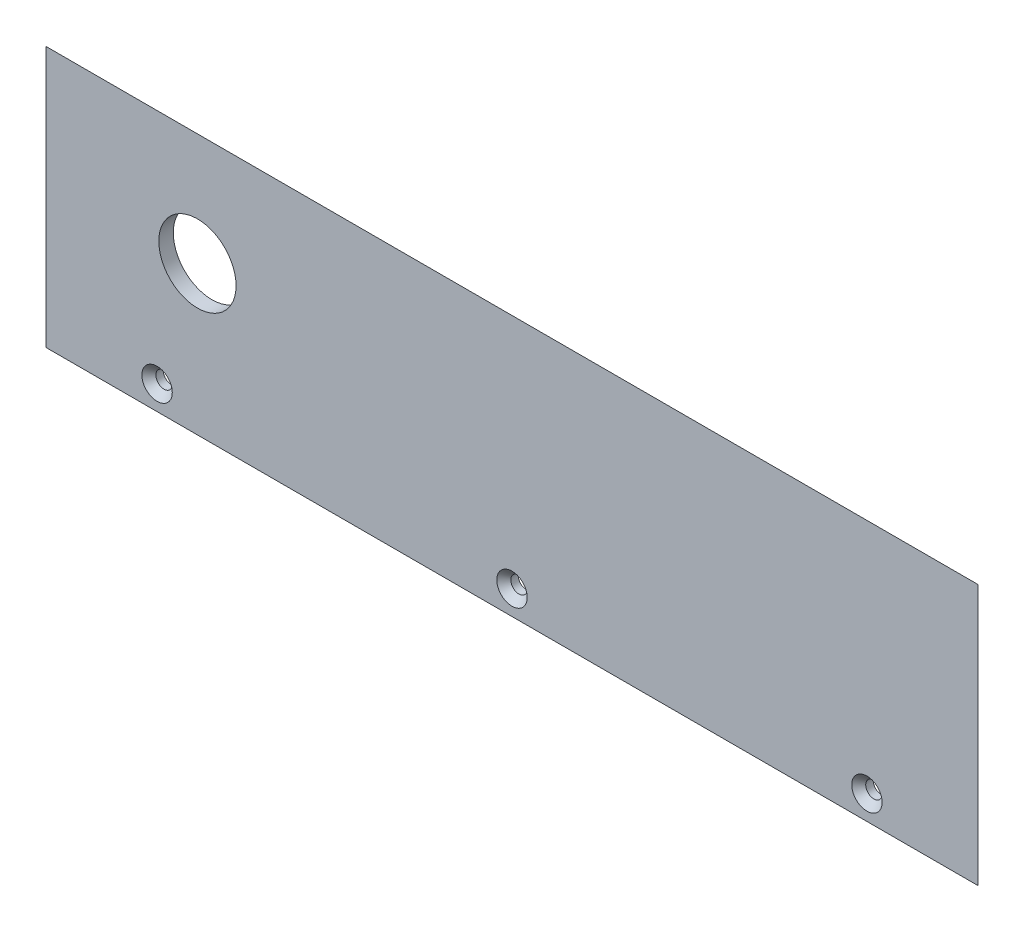
from build123d import *

# Parameters (mm, degrees)
SKETCH1_W                                      = 193
SKETCH1_H                                      = 54
BOSS_EXTRUDE1_DEPTH                            = 3
CHAMFER1_SIZE                                  = 3
CSK_FOR_M3_FLAT_HEAD_MACHINE_SCREW1_AT_2_COUNT = 2
CSK_FOR_M3_FLAT_HEAD_MACHINE_SCREW1_AT_2_PITCH = 73.5
CSK_FOR_M3_FLAT_HEAD_MACHINE_SCREW1_AT_3_COUNT = 2
CSK_FOR_M3_FLAT_HEAD_MACHINE_SCREW1_AT_3_PITCH = 147
SKETCH5_R                                      = 8
CUT_EXTRUDE1_DEPTH                             = 10


with BuildPart() as part:
    # Sketch1 → Boss-Extrude1 (new body)
    with BuildSketch(Plane.XY):
        with Locations((96.5, 27)):
            Rectangle(SKETCH1_W, SKETCH1_H)
    extrude(amount=BOSS_EXTRUDE1_DEPTH)

    # Chamfer1
    chamfer1_edges = [part.edges().sort_by_distance(p)[0] for p in [
        (0, 27, 0),
        (96.5, 54, 0),
        (193, 27, 0),
    ]]
    chamfer(chamfer1_edges, length=CHAMFER1_SIZE - 0.0001)  # a hair under: the kernel refuses the full size

    # Sketch3 → CSK for M3 Flat Head Machine Screw1 (revolve, cut)
    with BuildSketch(Plane(origin=(23, 5, 3), x_dir=(0, -1, 0), z_dir=(1, 0, 0))):
        Polygon((0, 0), (0, 3), (1.7, 3), (1.7, 1.45), (3.15, 0), align=None)
    csk_for_m3_flat_head_machine_screw1 = revolve(axis=Axis((23, 5, 9.35), (0, 0, -1)), mode=Mode.SUBTRACT)

    # CSK for M3 Flat Head Machine Screw1 at 2: CSK for M3 Flat Head Machine Screw1 ×2
    with Locations(*[(i * CSK_FOR_M3_FLAT_HEAD_MACHINE_SCREW1_AT_2_PITCH, 0, 0) for i in range(1, CSK_FOR_M3_FLAT_HEAD_MACHINE_SCREW1_AT_2_COUNT)]):
        add(csk_for_m3_flat_head_machine_screw1, mode=Mode.SUBTRACT)

    # CSK for M3 Flat Head Machine Screw1 at 3: CSK for M3 Flat Head Machine Screw1 ×2
    with Locations(*[(i * CSK_FOR_M3_FLAT_HEAD_MACHINE_SCREW1_AT_3_PITCH, 0, 0) for i in range(1, CSK_FOR_M3_FLAT_HEAD_MACHINE_SCREW1_AT_3_COUNT)]):
        add(csk_for_m3_flat_head_machine_screw1, mode=Mode.SUBTRACT)

    # Sketch5 → Cut-Extrude1 (cut)
    with BuildSketch(Plane.XY.offset(3)):
        with Locations((31.36, 30.75)):
            Circle(SKETCH5_R)
    extrude(amount=-CUT_EXTRUDE1_DEPTH, mode=Mode.SUBTRACT)


solid = part.part
